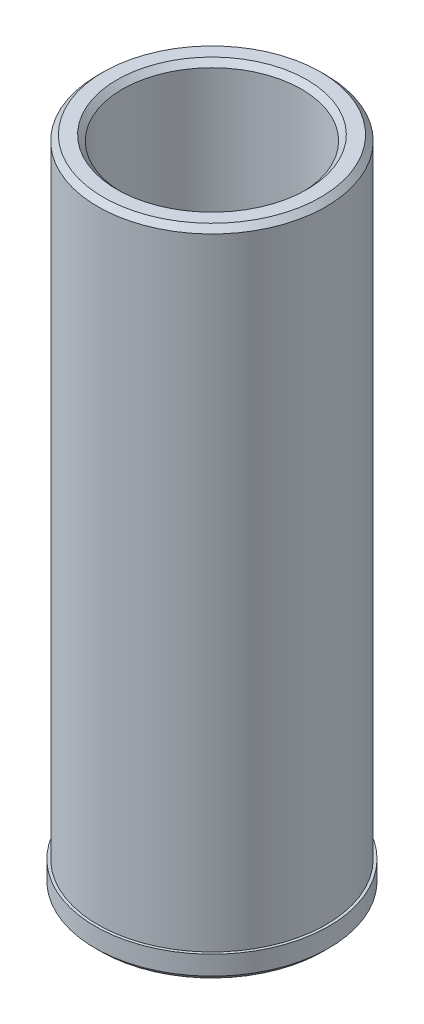
from build123d import *

# Parameters (mm, degrees)
OTW_R_GWINTOWANY_M161_D = 14


# Read off the part's stored shape, not the designer's step: Obrót1
with BuildPart() as part:
    # Obrót1 outline → Obrót1 (revolve)
    with BuildSketch(Plane.XY):
        Polygon((0, 10.090604818), (0, 0), (20.5, 0), (21.5, 1), (21.5, 4.5), (21, 4.5), (21, 119), (20, 120), (17.5, 120), (16.5, 119), (16.5, 13), align=None)
    revolve(axis=Axis((0, 0, 0), (0, 1, 0)))

    # Otwór gwintowany M161 (through all)
    with Locations(Plane(origin=(0, 0, 0), x_dir=(0, 0, -1), z_dir=(0, -1, 0))):
        with Locations((0, 0)):
            Hole(OTW_R_GWINTOWANY_M161_D / 2)


solid = part.part
